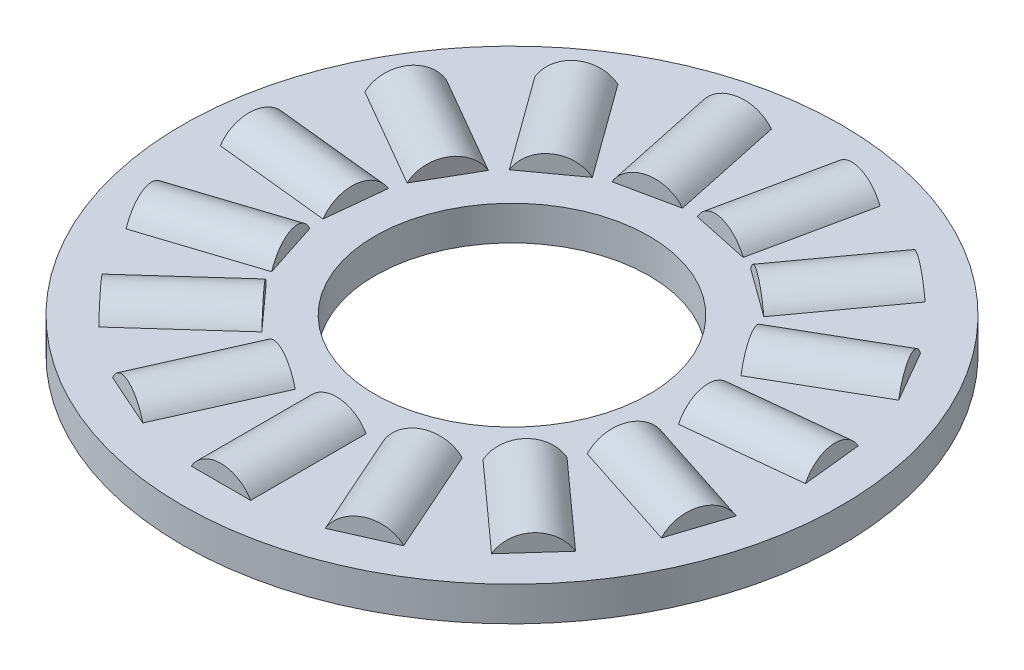
from build123d import *

# Parameters (mm, degrees)
SKETCH5_W         = 5.5626
SKETCH5_H         = 0.9921875
SKETCH3_W         = 3.33756
SKETCH3_H         = 0.9921875
SKETCH2_W         = 3.33756
SKETCH2_H         = 0.9921875
CIRPATTERN1_COUNT = 15
CIRPATTERN1_ANGLE = 336
CIRPATTERN2_COUNT = 15


with BuildPart() as part:
    # Sketch5 → Revolve3 (revolve)
    with BuildSketch(Plane(origin=(0, 0, 0), x_dir=(0, 0, -1), z_dir=(1, 0, 0))):
        with Locations((-6.7437, 0)):
            Rectangle(SKETCH5_W, SKETCH5_H)
    revolve(axis=Axis((0, -0.9921875, 0), (0, 1, 0)))

    # Sketch3 → Cut-Revolve1 (revolve, cut)
    with BuildSketch(Plane(origin=(0, 0, 0), x_dir=(0, 0, -1), z_dir=(1, 0, 0))):
        with Locations((-6.7437, 0.49609375)):
            Rectangle(SKETCH3_W, SKETCH3_H)
    cut_revolve1 = revolve(axis=Axis((0, 0, 8.41248), (0, 0, -1)), mode=Mode.SUBTRACT)

    # CirPattern2: Cut-Revolve1 ×15 about axis
    cirpattern2_axis = Axis((0, 0.9921875, 0), (0, -1, 0))
    for i in range(1, CIRPATTERN2_COUNT):
        add(cut_revolve1.rotate(cirpattern2_axis, i * 360 / CIRPATTERN2_COUNT), mode=Mode.SUBTRACT)


with BuildPart() as body_2:
    # Sketch2 → Revolve2 (revolve)
    with BuildSketch(Plane(origin=(0, 0, 0), x_dir=(0, 0, -1), z_dir=(1, 0, 0))):
        with Locations((-6.7437, 0.49609375)):
            Rectangle(SKETCH2_W, SKETCH2_H)
    revolve(axis=Axis((0, 0, 8.41248), (0, 0, -1)))


with BuildPart() as cirpattern1_1:
    # CirPattern1: pattern copy
    add(body_2.part.rotate(Axis((0, 0.9921875, 0), (0, -1, 0)), 1 * CIRPATTERN1_ANGLE / (CIRPATTERN1_COUNT - 1)))


with BuildPart() as cirpattern1_2:
    # CirPattern1: pattern copy
    add(body_2.part.rotate(Axis((0, 0.9921875, 0), (0, -1, 0)), 2 * CIRPATTERN1_ANGLE / (CIRPATTERN1_COUNT - 1)))


with BuildPart() as cirpattern1_3:
    # CirPattern1: pattern copy
    add(body_2.part.rotate(Axis((0, 0.9921875, 0), (0, -1, 0)), 3 * CIRPATTERN1_ANGLE / (CIRPATTERN1_COUNT - 1)))


with BuildPart() as cirpattern1_4:
    # CirPattern1: pattern copy
    add(body_2.part.rotate(Axis((0, 0.9921875, 0), (0, -1, 0)), 4 * CIRPATTERN1_ANGLE / (CIRPATTERN1_COUNT - 1)))


with BuildPart() as cirpattern1_5:
    # CirPattern1: pattern copy
    add(body_2.part.rotate(Axis((0, 0.9921875, 0), (0, -1, 0)), 5 * CIRPATTERN1_ANGLE / (CIRPATTERN1_COUNT - 1)))


with BuildPart() as cirpattern1_6:
    # CirPattern1: pattern copy
    add(body_2.part.rotate(Axis((0, 0.9921875, 0), (0, -1, 0)), 6 * CIRPATTERN1_ANGLE / (CIRPATTERN1_COUNT - 1)))


with BuildPart() as cirpattern1_7:
    # CirPattern1: pattern copy
    add(body_2.part.rotate(Axis((0, 0.9921875, 0), (0, -1, 0)), 7 * CIRPATTERN1_ANGLE / (CIRPATTERN1_COUNT - 1)))


with BuildPart() as cirpattern1_8:
    # CirPattern1: pattern copy
    add(body_2.part.rotate(Axis((0, 0.9921875, 0), (0, -1, 0)), 8 * CIRPATTERN1_ANGLE / (CIRPATTERN1_COUNT - 1)))


with BuildPart() as cirpattern1_9:
    # CirPattern1: pattern copy
    add(body_2.part.rotate(Axis((0, 0.9921875, 0), (0, -1, 0)), 9 * CIRPATTERN1_ANGLE / (CIRPATTERN1_COUNT - 1)))


with BuildPart() as cirpattern1_10:
    # CirPattern1: pattern copy
    add(body_2.part.rotate(Axis((0, 0.9921875, 0), (0, -1, 0)), 10 * CIRPATTERN1_ANGLE / (CIRPATTERN1_COUNT - 1)))


with BuildPart() as cirpattern1_11:
    # CirPattern1: pattern copy
    add(body_2.part.rotate(Axis((0, 0.9921875, 0), (0, -1, 0)), 11 * CIRPATTERN1_ANGLE / (CIRPATTERN1_COUNT - 1)))


with BuildPart() as cirpattern1_12:
    # CirPattern1: pattern copy
    add(body_2.part.rotate(Axis((0, 0.9921875, 0), (0, -1, 0)), 12 * CIRPATTERN1_ANGLE / (CIRPATTERN1_COUNT - 1)))


with BuildPart() as cirpattern1_13:
    # CirPattern1: pattern copy
    add(body_2.part.rotate(Axis((0, 0.9921875, 0), (0, -1, 0)), 13 * CIRPATTERN1_ANGLE / (CIRPATTERN1_COUNT - 1)))


with BuildPart() as cirpattern1_14:
    # CirPattern1: pattern copy
    add(body_2.part.rotate(Axis((0, 0.9921875, 0), (0, -1, 0)), 14 * CIRPATTERN1_ANGLE / (CIRPATTERN1_COUNT - 1)))


solid = Compound([part.part, body_2.part, cirpattern1_1.part, cirpattern1_2.part, cirpattern1_3.part, cirpattern1_4.part, cirpattern1_5.part, cirpattern1_6.part, cirpattern1_7.part, cirpattern1_8.part, cirpattern1_9.part, cirpattern1_10.part, cirpattern1_11.part, cirpattern1_12.part, cirpattern1_13.part, cirpattern1_14.part])
